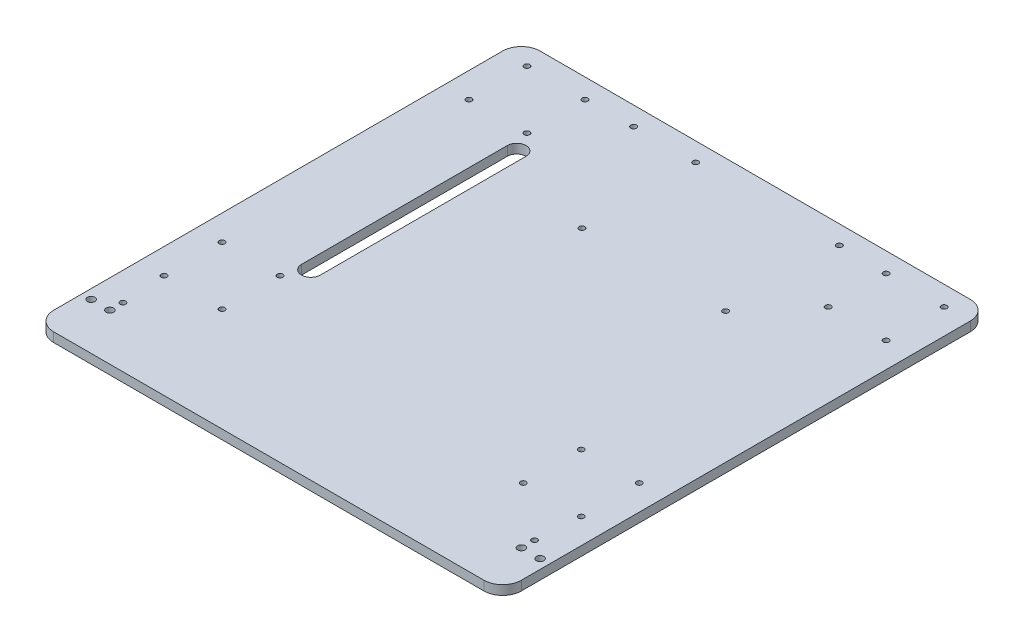
from build123d import *

# Parameters (mm, degrees)
SKETCH_1_W      = 250
SKETCH_1_H      = 260
SKETCH_1_R      = 1.5
SKETCH_1_R_2    = 2
EXTRUDE_1_DEPTH = 5
FILLET_2_R      = 10


with BuildPart() as part:
    # 草图1 → 凸台-拉伸1 (new body)
    with BuildSketch(Plane(origin=(0, 0, 0), x_dir=(1, 0, 0), z_dir=(0, 1, 0))):
        Rectangle(SKETCH_1_W, SKETCH_1_H)
        with Locations((-111.5, 119.5)):
            Circle(SKETCH_1_R, mode=Mode.SUBTRACT)
        with Locations((-80.5, 119.5)):
            Circle(SKETCH_1_R, mode=Mode.SUBTRACT)
        with Locations((-80.5, 88.5)):
            Circle(SKETCH_1_R, mode=Mode.SUBTRACT)
        with Locations((-111.5, 88.5)):
            Circle(SKETCH_1_R, mode=Mode.SUBTRACT)
        with Locations((-111.5, -43.5)):
            Circle(SKETCH_1_R, mode=Mode.SUBTRACT)
        with Locations((-80.5, -43.5)):
            Circle(SKETCH_1_R, mode=Mode.SUBTRACT)
        with Locations((-80.5, -74.5)):
            Circle(SKETCH_1_R, mode=Mode.SUBTRACT)
        with Locations((-111.5, -74.5)):
            Circle(SKETCH_1_R, mode=Mode.SUBTRACT)
        with Locations((111.5, -74.5)):
            Circle(SKETCH_1_R, mode=Mode.SUBTRACT)
        with Locations((80.5, -74.5)):
            Circle(SKETCH_1_R, mode=Mode.SUBTRACT)
        with Locations((80.5, -43.5)):
            Circle(SKETCH_1_R, mode=Mode.SUBTRACT)
        with Locations((111.5, -43.5)):
            Circle(SKETCH_1_R, mode=Mode.SUBTRACT)
        with Locations((111.5, 88.5)):
            Circle(SKETCH_1_R, mode=Mode.SUBTRACT)
        with Locations((80.5, 88.5)):
            Circle(SKETCH_1_R, mode=Mode.SUBTRACT)
        with Locations((80.5, 119.5)):
            Circle(SKETCH_1_R, mode=Mode.SUBTRACT)
        with Locations((111.5, 119.5)):
            Circle(SKETCH_1_R, mode=Mode.SUBTRACT)
        with Locations((-120, -105)):
            Circle(SKETCH_1_R_2, mode=Mode.SUBTRACT)
        with Locations((-110, -105)):
            Circle(SKETCH_1_R_2, mode=Mode.SUBTRACT)
        with Locations((110, -105)):
            Circle(SKETCH_1_R_2, mode=Mode.SUBTRACT)
        with Locations((120, -105)):
            Circle(SKETCH_1_R_2, mode=Mode.SUBTRACT)
        with Locations((-55, 120)):
            Circle(SKETCH_1_R, mode=Mode.SUBTRACT)
        with Locations((55, 120)):
            Circle(SKETCH_1_R, mode=Mode.SUBTRACT)
        with Locations((-110, -98)):
            Circle(SKETCH_1_R, mode=Mode.SUBTRACT)
        with Locations((110, -98)):
            Circle(SKETCH_1_R, mode=Mode.SUBTRACT)
        with Locations((55, 59.2)):
            Circle(SKETCH_1_R, mode=Mode.SUBTRACT)
        with Locations((-21.8, 59.2)):
            Circle(SKETCH_1_R, mode=Mode.SUBTRACT)
        with Locations((-21.8, 120)):
            Circle(SKETCH_1_R, mode=Mode.SUBTRACT)
        with BuildLine():
            Line((-70, 77.5), (-70, -32.5))
            ThreePointArc((-70, -32.5), (-75, -37.5), (-80, -32.5))
            Line((-80, -32.5), (-80, 77.5))
            ThreePointArc((-80, 77.5), (-75, 82.5), (-70, 77.5))
        make_face(mode=Mode.SUBTRACT)
    extrude(amount=EXTRUDE_1_DEPTH)

    # 圆角2
    fillet_2_edges = [part.edges().sort_by_distance(p)[0] for p in [
        (125, 2.5, -130),
        (125, 2.5, 130),
        (-125, 2.5, -130),
        (-125, 2.5, 130),
    ]]
    fillet(fillet_2_edges, radius=FILLET_2_R)


solid = part.part
